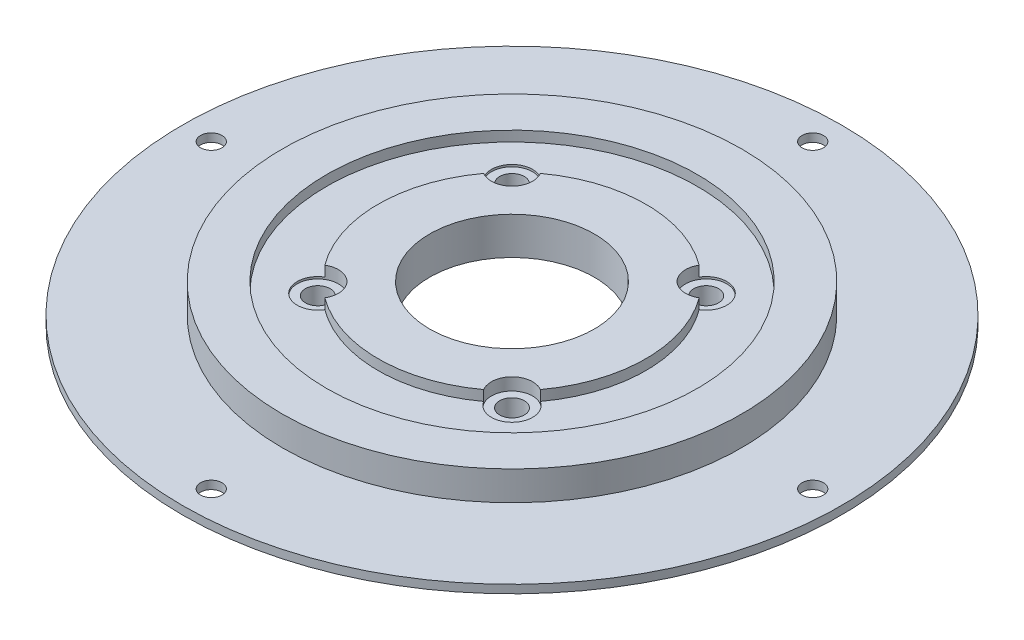
from build123d import *
from build123d.topology import SkipClean

# Parameters (mm, degrees)
SKETCH1_R                 = 80
SKETCH1_R_2               = 20
BOSS_EXTRUDE1_DEPTH       = 2
SKETCH2_R                 = 2.6
CUT_EXTRUDE1_DEPTH        = 114.154761279
SKETCH4_R                 = 3
CUT_EXTRUDE2_DEPTH        = 114.154761279
BOSS_EXTRUDE2_OUTLINE_R   = 55.75
BOSS_EXTRUDE2_OUTLINE_R_2 = 45
BOSS_EXTRUDE2_OUTLINE_R_3 = 20
BOSS_EXTRUDE2_DEPTH       = 2.5
MOVE_START                = 2
MOVE_FACE1_OUTLINE_R      = 55.75
MOVE_FACE1_OUTLINE_R_2    = 3
MOVE_FACE1_OUTLINE_R_3    = 20
MOVE_FACE1_DEPTH          = 4.6
MOVE_START_2              = 6.6
MOVE_FACE1_2_OUTLINE_R    = 55.75
MOVE_FACE1_2_OUTLINE_R_2  = 45
MOVE_FACE1_2_OUTLINE_R_3  = 20
MOVE_FACE1_2_DEPTH        = 2.5
CUT_EXTRUDE3_DEPTH        = 114.329431305
CUT_EXTRUDE3_DEPTH_BACK   = 0.5
SKETCH6_R                 = 5


# Read off the part's stored shape, not the designer's step: Boss-Extrude2, Move Face1
with BuildPart() as part:
    # Sketch1 → Boss-Extrude1 (new body)
    with BuildSketch(Plane(origin=(0, 0, 0), x_dir=(1, 0, 0), z_dir=(0, 1, 0))):
        with Locations(Location((0, 0, 0), (0, 0, 270))):
            Circle(SKETCH1_R)
        with Locations(Location((0, 0, 0), (0, 0, 270))):
            Circle(SKETCH1_R_2, mode=Mode.SUBTRACT)
    extrude(amount=BOSS_EXTRUDE1_DEPTH)

    # Sketch2 → Cut-Extrude1 (cut, through all)
    with BuildSketch(Plane(origin=(0, 2, 0), x_dir=(1, 0, 0), z_dir=(0, 1, 0))):
        with Locations(Location((0, 73, 0), (0, 0, 270))):
            Circle(SKETCH2_R)
        with Locations(Location((73, 0, 0), (0, 0, 270))):
            Circle(SKETCH2_R)
        with Locations(Location((0, -73, 0), (0, 0, 270))):
            Circle(SKETCH2_R)
        with Locations(Location((-73, 0, 0), (0, 0, 270))):
            Circle(SKETCH2_R)
    extrude(amount=-CUT_EXTRUDE1_DEPTH, mode=Mode.SUBTRACT)

    # Sketch4 → Cut-Extrude2 (cut, through all)
    with BuildSketch(Plane.XZ):
        with Locations(Location((-23.57, 23.57, 0), (0, 0, 270))):
            Circle(SKETCH4_R)
        with Locations(Location((23.57, 23.57, 0), (0, 0, 270))):
            Circle(SKETCH4_R)
        with Locations(Location((23.57, -23.57, 0), (0, 0, 270))):
            Circle(SKETCH4_R)
        with Locations(Location((-23.57, -23.57, 0), (0, 0, 270))):
            Circle(SKETCH4_R)
    extrude(amount=-CUT_EXTRUDE2_DEPTH, mode=Mode.SUBTRACT)

    # Boss-Extrude2 outline → Boss-Extrude2 (add)
    # profile 1 of 2: a face of its own
    with BuildSketch(Plane(origin=(0, 2, 0), x_dir=(1, 0, 0), z_dir=(0, 1, 0))):
        Circle(BOSS_EXTRUDE2_OUTLINE_R)
        Circle(BOSS_EXTRUDE2_OUTLINE_R_2, mode=Mode.SUBTRACT)
    # profile 2 of 2: a face of its own
    with BuildSketch(Plane(origin=(0, 2, 0), x_dir=(1, 0, 0), z_dir=(0, 1, 0))):
        with BuildLine():
            ThreePointArc((-24.903217208, -20.88252314), (-21.448679656, -21.448679656), (-20.88252314, -24.903217208))
            ThreePointArc((-20.88252314, -24.903217208), (0, -32.5), (20.88252314, -24.903217208))
            ThreePointArc((20.88252314, -24.903217208), (21.448679656, -21.448679656), (24.903217208, -20.88252314))
            ThreePointArc((24.903217208, -20.88252314), (32.5, 0), (24.903217208, 20.88252314))
            ThreePointArc((24.903217208, 20.88252314), (21.448679656, 21.448679656), (20.88252314, 24.903217208))
            ThreePointArc((20.88252314, 24.903217208), (0, 32.5), (-20.88252314, 24.903217208))
            ThreePointArc((-20.88252314, 24.903217208), (-21.448679656, 21.448679656), (-24.903217208, 20.88252314))
            ThreePointArc((-24.903217208, 20.88252314), (-32.5, 0), (-24.903217208, -20.88252314))
        make_face()
        Circle(BOSS_EXTRUDE2_OUTLINE_R_3, mode=Mode.SUBTRACT)
    extrude(amount=BOSS_EXTRUDE2_DEPTH)

    # Move Face1 outline → Move Face1 (add)
    with SkipClean():  # the faces are left unmerged after this step: merging them gives an invalid solid
        with BuildSketch(Plane(origin=(0, 0, 0), x_dir=(1, 0, 0), z_dir=(0, 1, 0)).offset(MOVE_START)):
            Circle(MOVE_FACE1_OUTLINE_R)
            with Locations((-23.57, -23.57)):
                Circle(MOVE_FACE1_OUTLINE_R_2, mode=Mode.SUBTRACT)
            with Locations((-23.57, 23.57)):
                Circle(MOVE_FACE1_OUTLINE_R_2, mode=Mode.SUBTRACT)
            with Locations((23.57, 23.57)):
                Circle(MOVE_FACE1_OUTLINE_R_2, mode=Mode.SUBTRACT)
            with Locations((23.57, -23.57)):
                Circle(MOVE_FACE1_OUTLINE_R_2, mode=Mode.SUBTRACT)
            Circle(MOVE_FACE1_OUTLINE_R_3, mode=Mode.SUBTRACT)
        extrude(amount=MOVE_FACE1_DEPTH)

    # Move Face1 2 outline → Move Face1 2 (add)
    # profile 1 of 2: a face of its own
    with SkipClean():  # the faces are left unmerged after this step: merging them gives an invalid solid
        with BuildSketch(Plane(origin=(0, 0, 0), x_dir=(1, 0, 0), z_dir=(0, 1, 0)).offset(MOVE_START_2)):
            Circle(MOVE_FACE1_2_OUTLINE_R)
            Circle(MOVE_FACE1_2_OUTLINE_R_2, mode=Mode.SUBTRACT)
        # profile 2 of 2: a face of its own
        with BuildSketch(Plane(origin=(0, 0, 0), x_dir=(1, 0, 0), z_dir=(0, 1, 0)).offset(MOVE_START_2)):
            with BuildLine():
                ThreePointArc((-24.903217208, -20.88252314), (-21.448679656, -21.448679656), (-20.88252314, -24.903217208))
                ThreePointArc((-20.88252314, -24.903217208), (0, -32.5), (20.88252314, -24.903217208))
                ThreePointArc((20.88252314, -24.903217208), (21.448679656, -21.448679656), (24.903217208, -20.88252314))
                ThreePointArc((24.903217208, -20.88252314), (32.5, 0), (24.903217208, 20.88252314))
                ThreePointArc((24.903217208, 20.88252314), (21.448679656, 21.448679656), (20.88252314, 24.903217208))
                ThreePointArc((20.88252314, 24.903217208), (0, 32.5), (-20.88252314, 24.903217208))
                ThreePointArc((-20.88252314, 24.903217208), (-21.448679656, 21.448679656), (-24.903217208, 20.88252314))
                ThreePointArc((-24.903217208, 20.88252314), (-32.5, 0), (-24.903217208, -20.88252314))
            make_face()
            Circle(MOVE_FACE1_2_OUTLINE_R_3, mode=Mode.SUBTRACT)
        extrude(amount=MOVE_FACE1_2_DEPTH)

    # Sketch6 → Cut-Extrude3 (cut, two sides: drawn at the far end of the back side and taken through both)
    with SkipClean():  # the faces are left unmerged after this step: merging them gives an invalid solid
        with BuildSketch(Plane(origin=(0, 6.6, 0), x_dir=(1, 0, 0), z_dir=(0, 1, 0)).offset(-CUT_EXTRUDE3_DEPTH_BACK)):
            with Locations(Location((23.57, 23.57, 0), (0, 0, 148.858312263))):
                Circle(SKETCH6_R)
            with Locations(Location((-23.57, 23.57, 0), (0, 0, 31.141687737))):
                Circle(SKETCH6_R)
            with Locations(Location((23.57, -23.57, 0), (0, 0, 58.858312263))):
                Circle(SKETCH6_R)
            with Locations(Location((-23.57, -23.57, 0), (0, 0, 121.141687737))):
                Circle(SKETCH6_R)
        extrude(amount=CUT_EXTRUDE3_DEPTH + CUT_EXTRUDE3_DEPTH_BACK, mode=Mode.SUBTRACT)


solid = part.part
